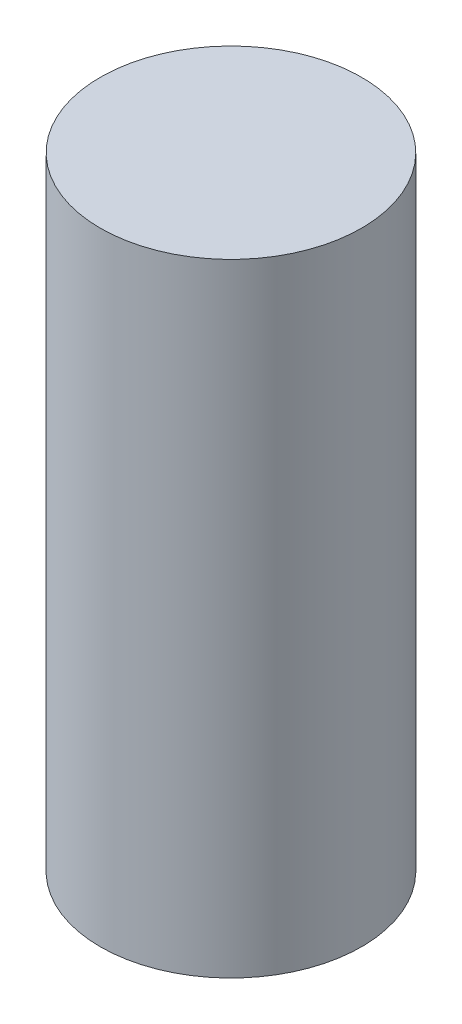
from build123d import *

# Parameters (mm, degrees)
ESQUISSE1_R        = 5.25
BOSS_EXTRU_1_DEPTH = 25


with BuildPart() as part:
    # Esquisse1 → Boss.-Extru.1 (new body)
    with BuildSketch(Plane(origin=(0, 0, 0), x_dir=(1, 0, 0), z_dir=(0, 1, 0))):
        Circle(ESQUISSE1_R)
    extrude(amount=BOSS_EXTRU_1_DEPTH)


solid = part.part
